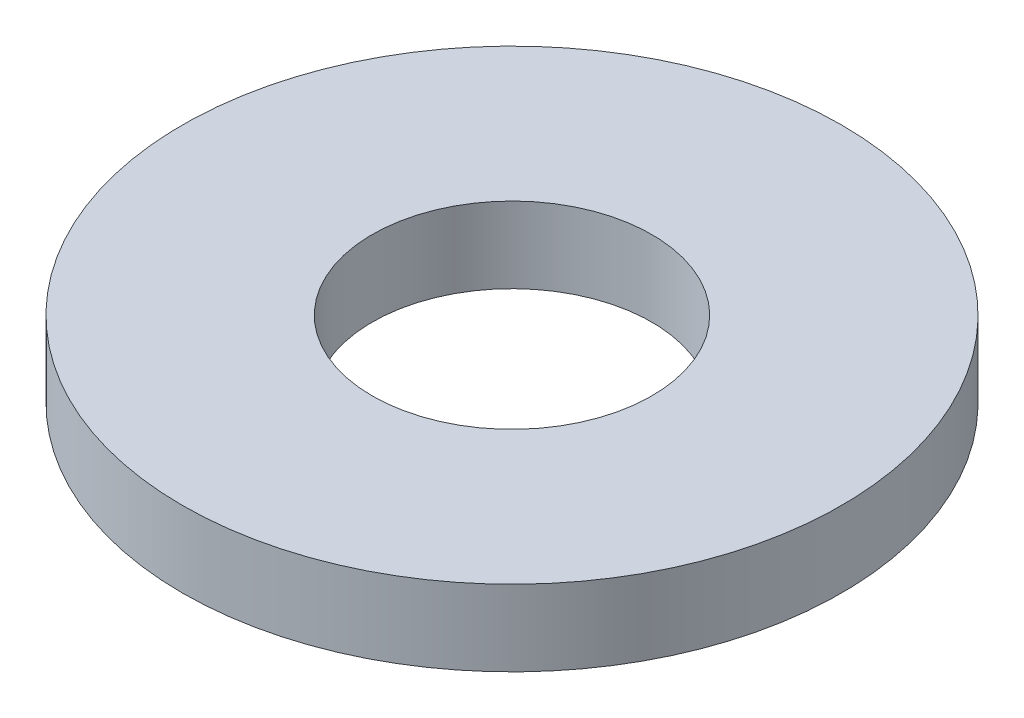
from build123d import *

# Parameters (mm, degrees)
SKETCH1_R           = 82.5
BOSS_EXTRUDE1_DEPTH = 19
SKETCH2_R           = 35
CUT_EXTRUDE1_DEPTH  = 119.209559681


with BuildPart() as part:
    # Sketch1 → Boss-Extrude1 (new body)
    with BuildSketch(Plane(origin=(0, 0, 0), x_dir=(1, 0, 0), z_dir=(0, 1, 0))):
        Circle(SKETCH1_R)
    extrude(amount=BOSS_EXTRUDE1_DEPTH)

    # Sketch2 → Cut-Extrude1 (cut, through all)
    with BuildSketch(Plane(origin=(0, 0, 0), x_dir=(1, 0, 0), z_dir=(0, 1, 0))):
        Circle(SKETCH2_R)
    extrude(amount=CUT_EXTRUDE1_DEPTH, mode=Mode.SUBTRACT)


solid = part.part
